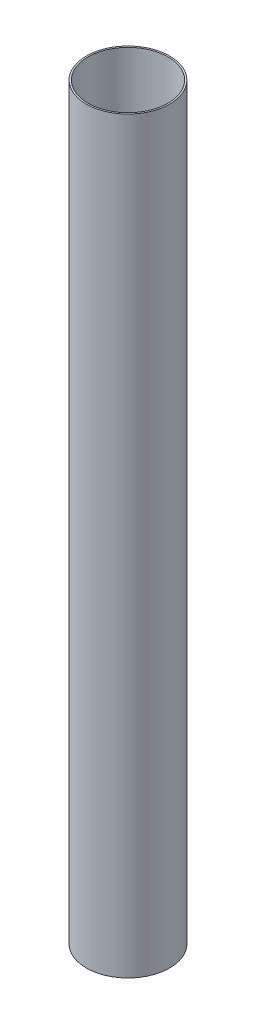
from build123d import *

# Parameters (mm, degrees)
SKETCH1_R            = 39.624
SKETCH1_R_2          = 38.1
TUBE_EXTRUSION_DEPTH = 711.2


with BuildPart() as part:
    # Sketch1 → Tube Extrusion (new body)
    with BuildSketch(Plane(origin=(0, 0, 0), x_dir=(1, 0, 0), z_dir=(0, 1, 0))):
        Circle(SKETCH1_R)
        Circle(SKETCH1_R_2, mode=Mode.SUBTRACT)
    extrude(amount=TUBE_EXTRUSION_DEPTH)


solid = part.part
